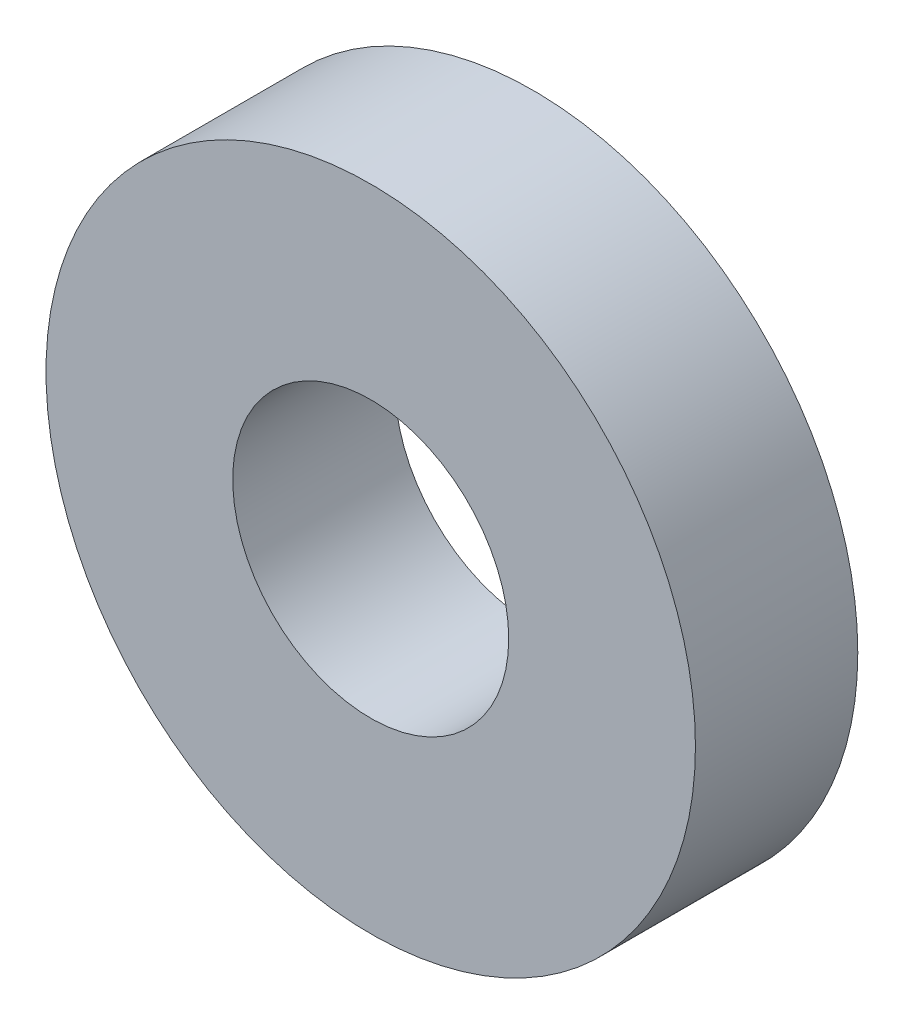
from build123d import *

# Parameters (mm, degrees)
IZIM1_R            = 10
IZIM1_R_2          = 4.25
TABAN_FLAN_1_DEPTH = 5


# Sheet-metal steps are written as plain solids
with BuildPart() as part:
    # Çizim1 → Taban-Flanş1 (new body)
    with BuildSketch(Plane.XY):
        Circle(IZIM1_R)
        Circle(IZIM1_R_2, mode=Mode.SUBTRACT)
    extrude(amount=-TABAN_FLAN_1_DEPTH)


solid = part.part
